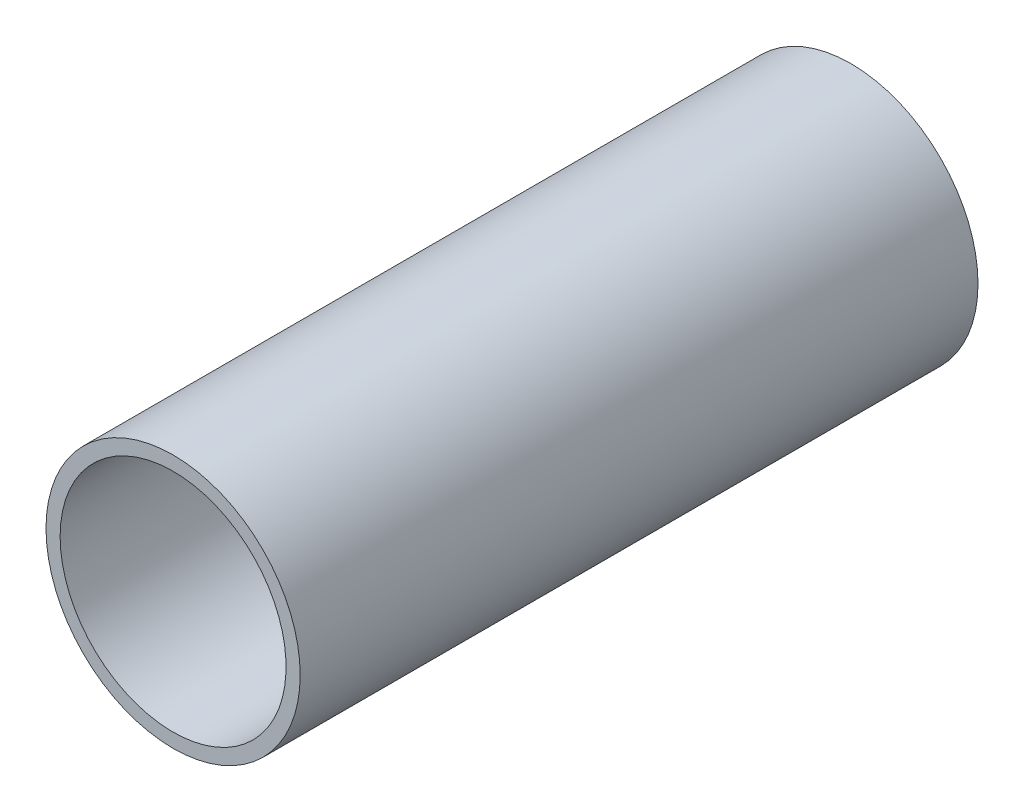
from build123d import *

# Parameters (mm, degrees)
SKETCH1_R           = 57.15
SKETCH1_R_2         = 50.8
BOSS_EXTRUDE1_DEPTH = 152.4


with BuildPart() as part:
    # Sketch1 → Boss-Extrude1 (new, symmetric)
    with BuildSketch(Plane.XY):
        Circle(SKETCH1_R)
        Circle(SKETCH1_R_2, mode=Mode.SUBTRACT)
    extrude(amount=BOSS_EXTRUDE1_DEPTH, both=True)


solid = part.part
